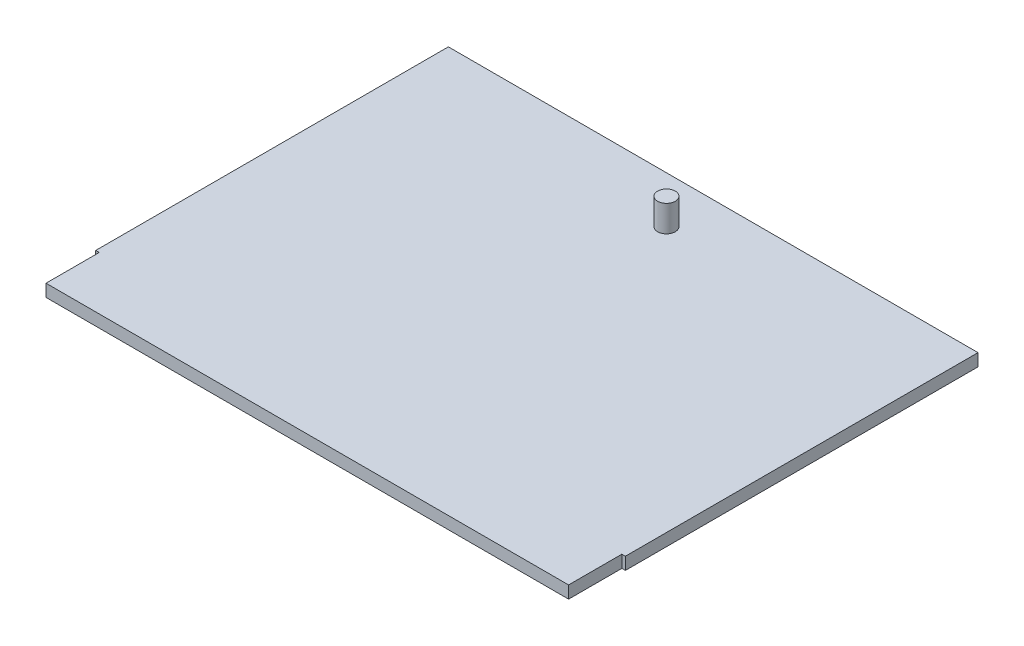
from build123d import *

# Parameters (mm, degrees)
BOSS_EXTRUDE1_DEPTH = 3.5
SKETCH2_R           = 2.5
BOSS_EXTRUDE2_DEPTH = 7.5


with BuildPart() as part:
    # Sketch1 → Boss-Extrude1 (new body)
    with BuildSketch(Plane(origin=(0, 0, 0), x_dir=(1, 0, 0), z_dir=(0, 1, 0))):
        Polygon((-5.476041667, 107.710069444), (-5.476041667, 7.710069444), (-4.476041667, 7.710069444), (-4.476041667, -7.389930556), (143.723958333, -7.389930556), (143.723958333, 7.710069444), (144.723958333, 7.710069444), (144.723958333, 107.710069444), align=None)
    extrude(amount=BOSS_EXTRUDE1_DEPTH)

    # Sketch2 → Boss-Extrude2 (add)
    with BuildSketch(Plane(origin=(0, 3.5, 0), x_dir=(1, 0, 0), z_dir=(0, 1, 0))):
        with Locations((69.623958333, 94.460827619)):
            Circle(SKETCH2_R)
    extrude(amount=BOSS_EXTRUDE2_DEPTH)


solid = part.part
